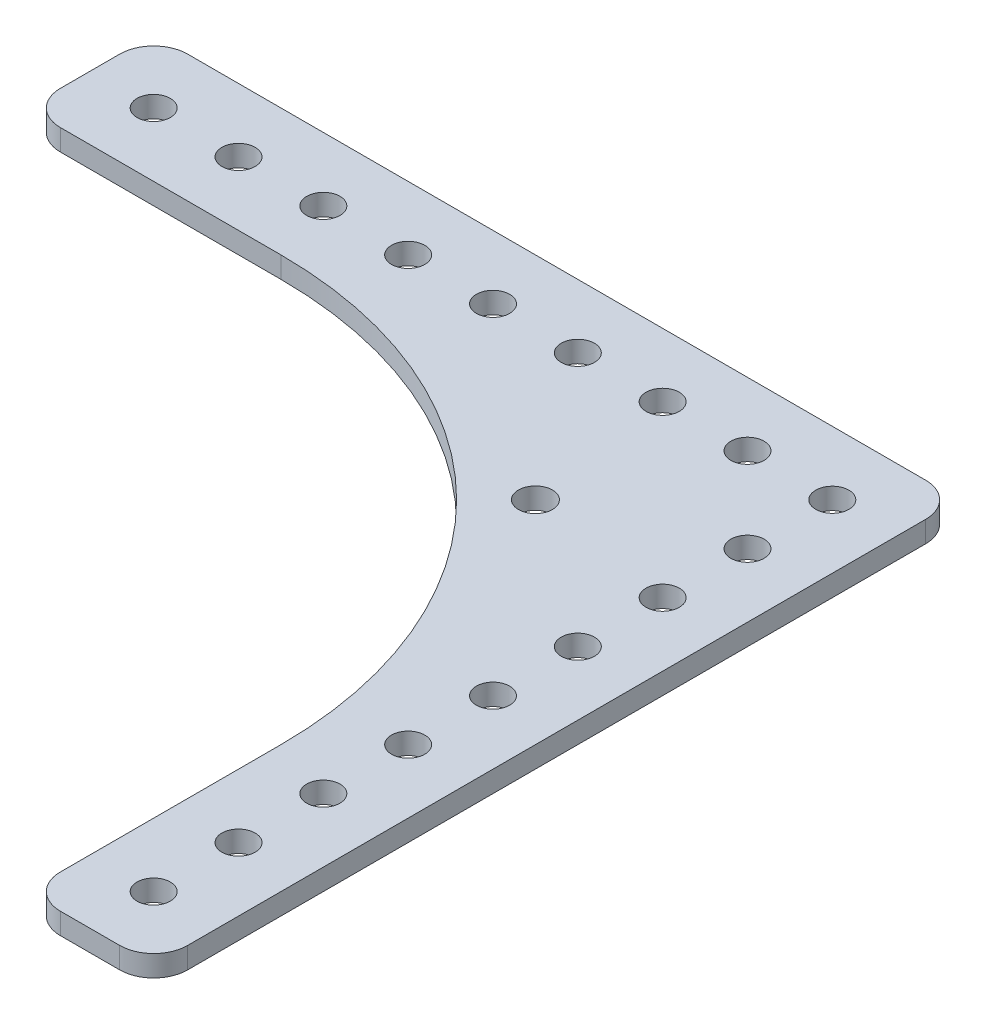
from build123d import *

# Parameters (mm, degrees)
SKETCH1_R           = 2.4892
SKETCH1_R_2         = 2.54
BOSS_EXTRUDE1_DEPTH = 3.175


with BuildPart() as part:
    # Sketch1 → Boss-Extrude1 (new body)
    with BuildSketch(Plane(origin=(0, 0, 0), x_dir=(1, 0, 0), z_dir=(0, 1, 0))):
        with BuildLine():
            Line((0, 63.5), (-33.02, 63.5))
            ThreePointArc((-33.02, 63.5), (-36.612102448, 64.987897552), (-38.1, 68.58))
            Line((-38.1, 68.58), (-38.1, 77.47))
            ThreePointArc((-38.1, 77.47), (-36.612102448, 81.062102448), (-33.02, 82.55))
            Line((-33.02, 82.55), (77.47, 82.55))
            ThreePointArc((77.47, 82.55), (81.062102448, 81.062102448), (82.55, 77.47))
            Line((82.55, 77.47), (82.55, -33.02))
            ThreePointArc((82.55, -33.02), (81.062102448, -36.612102448), (77.47, -38.1))
            Line((77.47, -38.1), (68.58, -38.1))
            ThreePointArc((68.58, -38.1), (64.987897552, -36.612102448), (63.5, -33.02))
            Line((63.5, -33.02), (63.5, 0))
            ThreePointArc((63.5, 0), (44.901280605, 44.901280605), (0, 63.5))
        make_face()
        with Locations((-28.575, 73.025)):
            Circle(SKETCH1_R, mode=Mode.SUBTRACT)
        with Locations((-15.875, 73.025)):
            Circle(SKETCH1_R, mode=Mode.SUBTRACT)
        with Locations((-3.175, 73.025)):
            Circle(SKETCH1_R, mode=Mode.SUBTRACT)
        with Locations((9.525, 73.025)):
            Circle(SKETCH1_R, mode=Mode.SUBTRACT)
        with Locations((22.225, 73.025)):
            Circle(SKETCH1_R, mode=Mode.SUBTRACT)
        with Locations((34.925, 73.025)):
            Circle(SKETCH1_R, mode=Mode.SUBTRACT)
        with Locations((47.625, 73.025)):
            Circle(SKETCH1_R, mode=Mode.SUBTRACT)
        with Locations((60.325, 73.025)):
            Circle(SKETCH1_R, mode=Mode.SUBTRACT)
        with Locations((73.025, 73.025)):
            Circle(SKETCH1_R, mode=Mode.SUBTRACT)
        with Locations((73.025, 60.325)):
            Circle(SKETCH1_R, mode=Mode.SUBTRACT)
        with Locations((73.025, 47.625)):
            Circle(SKETCH1_R, mode=Mode.SUBTRACT)
        with Locations((73.025, 34.925)):
            Circle(SKETCH1_R, mode=Mode.SUBTRACT)
        with Locations((73.025, 22.225)):
            Circle(SKETCH1_R, mode=Mode.SUBTRACT)
        with Locations((73.025, 9.525)):
            Circle(SKETCH1_R, mode=Mode.SUBTRACT)
        with Locations((73.025, -3.175)):
            Circle(SKETCH1_R, mode=Mode.SUBTRACT)
        with Locations((73.025, -15.875)):
            Circle(SKETCH1_R, mode=Mode.SUBTRACT)
        with Locations((73.025, -28.575)):
            Circle(SKETCH1_R, mode=Mode.SUBTRACT)
        with Locations((50.8, 50.8)):
            Circle(SKETCH1_R_2, mode=Mode.SUBTRACT)
    extrude(amount=BOSS_EXTRUDE1_DEPTH)


solid = part.part
